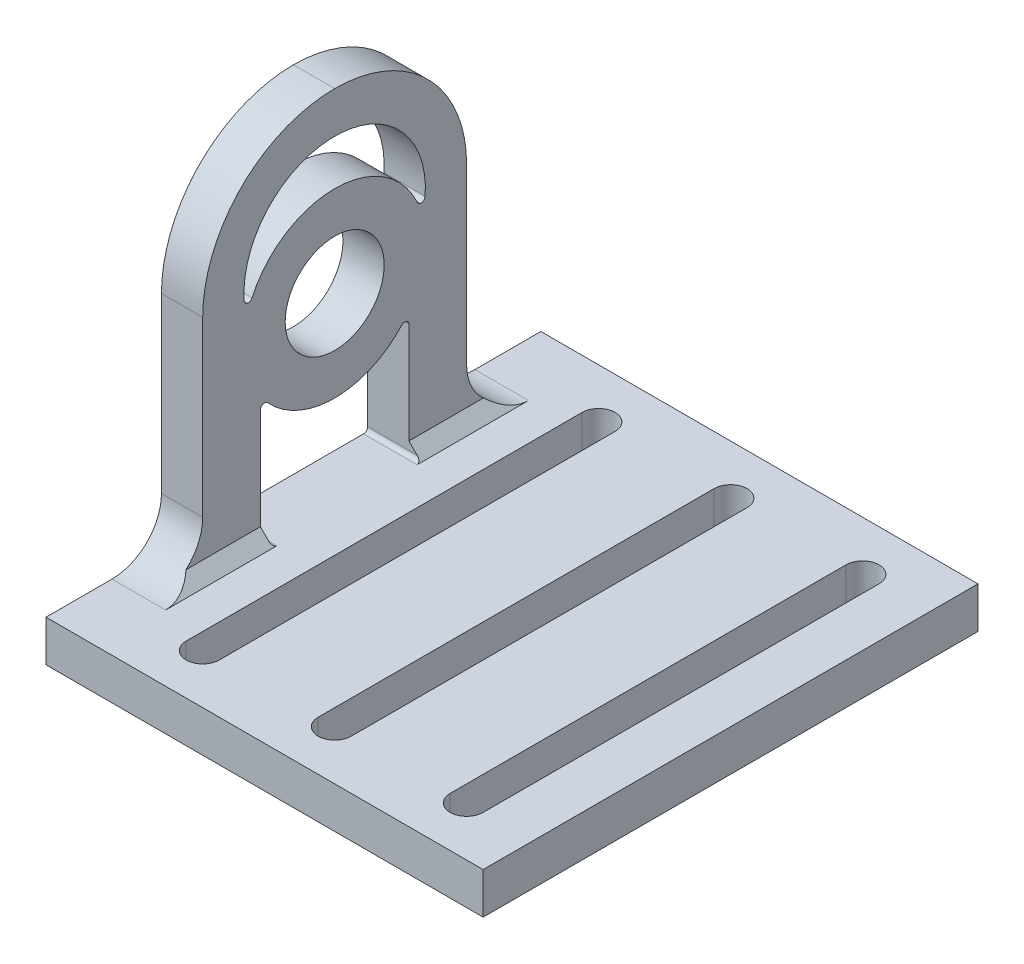
from build123d import *

# Parameters (mm, degrees)
SKETCH1_W           = 48
SKETCH1_H           = 60
BOSS_EXTRUDE1_DEPTH = 5
SKETCH2_W           = 60
SKETCH2_H           = 5
BOSS_EXTRUDE2_DEPTH = 5
SKETCH4_W           = 5
SKETCH4_H           = 32
BOSS_EXTRUDE3_DEPTH = 43
FILLET2_R           = 6
CHAMFER1_SIZE       = 1.5
SKETCH6_R           = 6
CUT_EXTRUDE1_DEPTH  = 94.343451832
FILLET3_R           = 16
CUT_EXTRUDE2_DEPTH  = 94.343451832


with BuildPart() as part:
    # Sketch1 → Boss-Extrude1 (new body)
    with BuildSketch(Plane(origin=(0, 0, 0), x_dir=(1, 0, 0), z_dir=(0, 1, 0))):
        with Locations((24, -30)):
            Rectangle(SKETCH1_W, SKETCH1_H)
        with BuildLine():
            Line((10, -6), (10, -54))
            ThreePointArc((10, -54), (8, -56), (6, -54))
            Line((6, -54), (6, -6))
            ThreePointArc((6, -6), (8, -4), (10, -6))
        make_face(mode=Mode.SUBTRACT)
        with BuildLine():
            Line((38, -6), (38, -54))
            ThreePointArc((38, -54), (40, -56), (42, -54))
            Line((42, -54), (42, -6))
            ThreePointArc((42, -6), (40, -4), (38, -6))
        make_face(mode=Mode.SUBTRACT)
        with BuildLine():
            Line((26, -6), (26, -54))
            ThreePointArc((26, -54), (24, -56), (22, -54))
            Line((22, -54), (22, -6))
            ThreePointArc((22, -6), (24, -4), (26, -6))
        make_face(mode=Mode.SUBTRACT)
    extrude(amount=BOSS_EXTRUDE1_DEPTH)

    # Sketch2 → Boss-Extrude2 (add)
    with BuildSketch(Plane.ZY):
        with Locations((30, 2.5)):
            Rectangle(SKETCH2_W, SKETCH2_H)
    extrude(amount=BOSS_EXTRUDE2_DEPTH)

    # Sketch4 → Boss-Extrude3 (add)
    with BuildSketch(Plane(origin=(0, 5, 0), x_dir=(1, 0, 0), z_dir=(0, 1, 0))):
        with Locations((-2.5, -30)):
            Rectangle(SKETCH4_W, SKETCH4_H)
    extrude(amount=BOSS_EXTRUDE3_DEPTH)

    # Fillet2
    fillet2_edges = [part.edges().sort_by_distance(p)[0] for p in [
        (-2.5, 5, 46),
        (-2.5, 5, 14),
    ]]
    fillet(fillet2_edges, radius=FILLET2_R)

    # Chamfer1
    chamfer1_edges = [part.edges().sort_by_distance(p)[0] for p in [
        (0, 5, 30),
    ]]
    chamfer(chamfer1_edges, length=CHAMFER1_SIZE)

    # Sketch6 → Cut-Extrude1 (cut, through all)
    with BuildSketch(Plane.ZY.offset(5)):
        with Locations((30, 26.5)):
            Circle(SKETCH6_R)
    extrude(amount=-CUT_EXTRUDE1_DEPTH, mode=Mode.SUBTRACT)

    # Fillet3
    fillet3_edges = [part.edges().sort_by_distance(p)[0] for p in [
        (-2.5, 48, 46),
        (-2.5, 48, 14),
    ]]
    fillet(fillet3_edges, radius=FILLET3_R - 0.0001)  # a hair under: the kernel refuses the full size

    # Sketch7 → Cut-Extrude2 (cut, through all)
    with BuildSketch(Plane.ZY.offset(5)):
        with BuildLine():
            Line((21, 18.754033308), (21, 5.5))
            ThreePointArc((21, 5.5), (21.146446609, 5.146446609), (21.5, 5))
            Line((21.5, 5), (38.5, 5))
            ThreePointArc((38.5, 5), (38.853553391, 5.146446609), (39, 5.5))
            Line((39, 5.5), (39, 18.754033308))
            ThreePointArc((39, 18.754033308), (38.68057878, 19.220285712), (38.130434783, 19.090814468))
            ThreePointArc((38.130434783, 19.090814468), (30, 15.5), (21.869565217, 19.090814468))
            ThreePointArc((21.869565217, 19.090814468), (21.31942122, 19.220285712), (21, 18.754033308))
        make_face()
        with BuildLine():
            ThreePointArc((40.971902892, 31.214285714), (30, 43), (19.028097108, 31.214285714))
            ThreePointArc((19.028097108, 31.214285714), (19.438706545, 30.757825209), (19.982175621, 31.043478261))
            ThreePointArc((19.982175621, 31.043478261), (30, 37.5), (40.017824379, 31.043478261))
            ThreePointArc((40.017824379, 31.043478261), (40.561293455, 30.757825209), (40.971902892, 31.214285714))
        make_face()
    extrude(amount=-CUT_EXTRUDE2_DEPTH, mode=Mode.SUBTRACT)


solid = part.part
